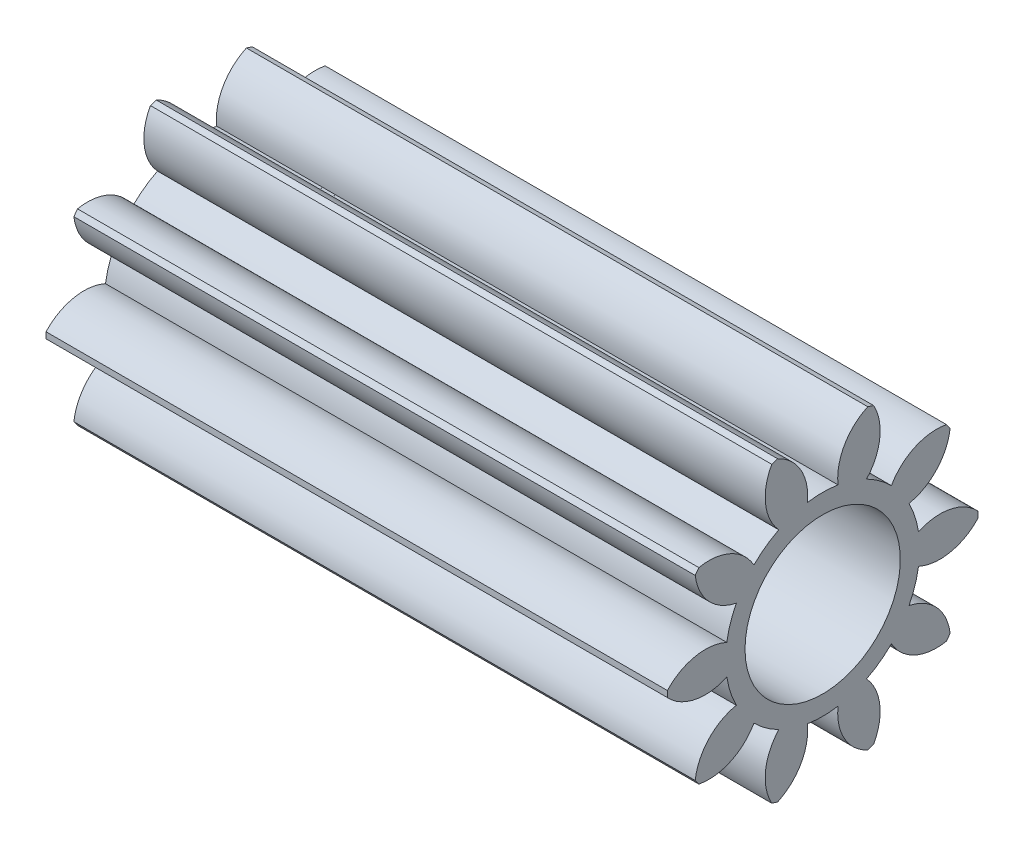
from build123d import *

# Parameters (mm, degrees)
BASPROSKE_W     = 12
BASPROSKE_H     = 3
TOOTHCUT_DEPTH  = 13.727922061
TEETHCUTS_COUNT = 10
TEETHCUTS_ANGLE = 324
BORSKE_R        = 1.5
BORE_DEPTH      = 50.0000508


with BuildPart() as part:
    # BasProSke → Base-Revolve (revolve)
    with BuildSketch(Plane(origin=(0, 0, 0), x_dir=(1, 0, 0), z_dir=(0, 1, 0))):
        with Locations((6, 1.5)):
            Rectangle(BASPROSKE_W, BASPROSKE_H)
    revolve(axis=Axis((-10, 0, 0), (1, 0, 0)))

    # TooCutSke → ToothCut (cut, through all)
    with BuildSketch(Plane(origin=(0, 0, 0), x_dir=(0, 0, -1), z_dir=(1, 0, 0))):
        with BuildLine():
            ThreePointArc((0.296449938, 1.850403587), (0, 1.874), (-0.296449938, 1.850403587))
            ThreePointArc((-0.296449938, 1.850403587), (-0.428089565, 2.470295585), (-0.905889751, 2.886591228))
            ThreePointArc((-0.905889751, 2.886591228), (0, 3.0254), (0.905889751, 2.886591228))
            ThreePointArc((0.905889751, 2.886591228), (0.428089565, 2.470295585), (0.296449938, 1.850403587))
        make_face()
    toothcut = extrude(amount=TOOTHCUT_DEPTH, mode=Mode.SUBTRACT)

    # TeethCuts: ToothCut ×10 about axis
    teethcuts_axis = Axis((-10, 0, 0), (1, 0, 0))
    for i in range(1, TEETHCUTS_COUNT):
        add(toothcut.rotate(teethcuts_axis, i * TEETHCUTS_ANGLE / (TEETHCUTS_COUNT - 1)), mode=Mode.SUBTRACT)

    # BorSke → Bore (cut, symmetric)
    with BuildSketch(Plane(origin=(0, 0, 0), x_dir=(0, 0, -1), z_dir=(1, 0, 0))):
        Circle(BORSKE_R)
    extrude(amount=BORE_DEPTH, both=True, mode=Mode.SUBTRACT)


solid = part.part
